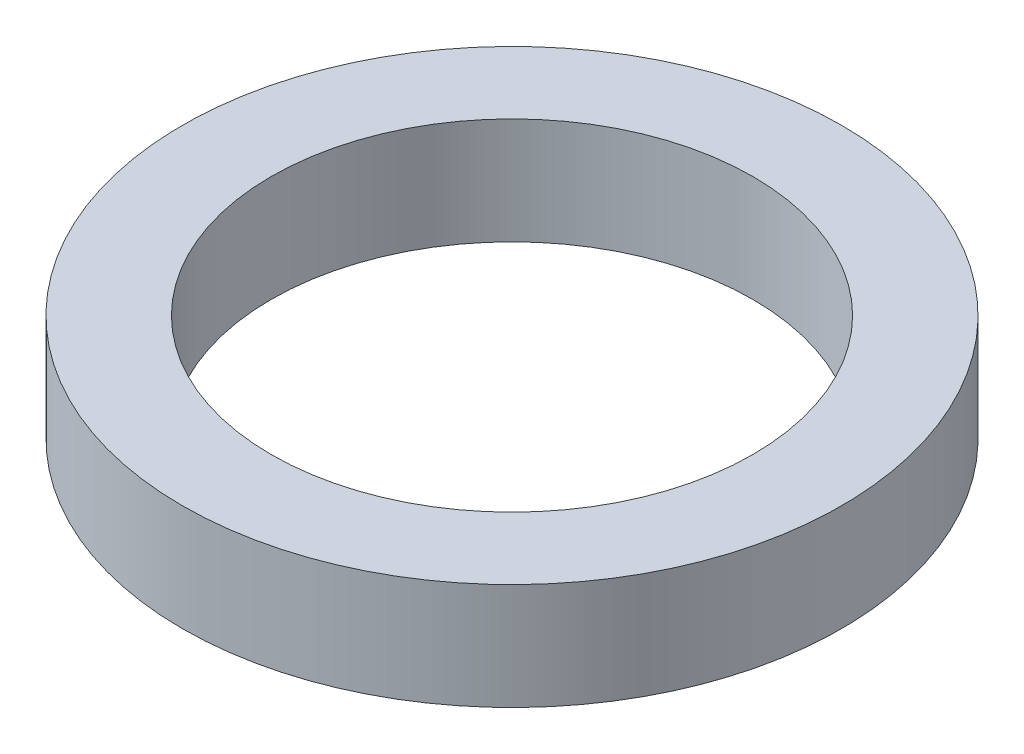
from build123d import *

# Parameters (mm, degrees)
SKETCH1_R           = 65
BOSS_EXTRUDE1_DEPTH = 21
SKETCH2_R           = 47.5
CUT_EXTRUDE1_DEPTH  = 95.292099351


with BuildPart() as part:
    # Sketch1 → Boss-Extrude1 (new body)
    with BuildSketch(Plane(origin=(0, 0, 0), x_dir=(1, 0, 0), z_dir=(0, 1, 0))):
        Circle(SKETCH1_R)
    extrude(amount=BOSS_EXTRUDE1_DEPTH)

    # Sketch2 → Cut-Extrude1 (cut, through all)
    with BuildSketch(Plane(origin=(0, 0, 0), x_dir=(1, 0, 0), z_dir=(0, 1, 0))):
        Circle(SKETCH2_R)
    extrude(amount=CUT_EXTRUDE1_DEPTH, mode=Mode.SUBTRACT)


solid = part.part
